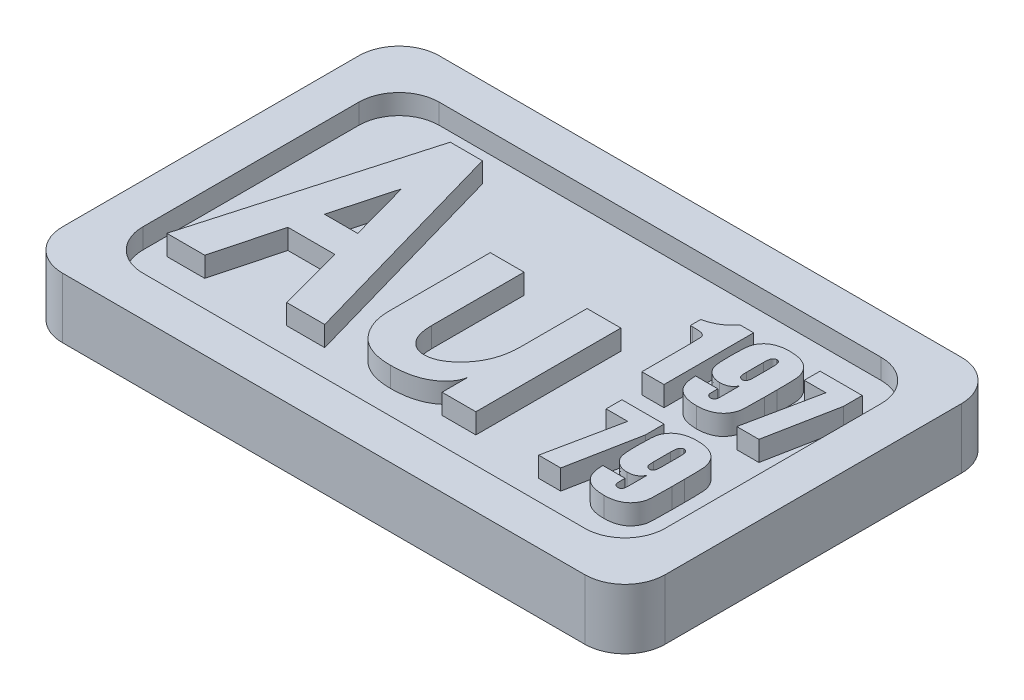
from build123d import *

# Parameters (mm, degrees)
SKETCH_1_W          = 30
SKETCH_1_H          = 18.75
EXTRUDE_1_DEPTH     = 3
SKETCH_2_W          = 26
SKETCH_2_H          = 14.75
CUT_EXTRUDE_1_DEPTH = 1
EXTRUDE_2_DEPTH     = 1
FILLET_1_R          = 2


# Read off the part's stored shape, not the designer's step: 凸台-拉伸2
with BuildPart() as part:
    # 草图1 → 凸台-拉伸1 (new body)
    with BuildSketch(Plane(origin=(0, 0, 0), x_dir=(1, 0, 0), z_dir=(0, 1, 0))):
        Rectangle(SKETCH_1_W, SKETCH_1_H)
    extrude(amount=EXTRUDE_1_DEPTH)

    # 草图2 → 切除-拉伸1 (cut)
    with BuildSketch(Plane(origin=(0, 3, 0), x_dir=(1, 0, 0), z_dir=(0, 1, 0))):
        Rectangle(SKETCH_2_W, SKETCH_2_H)
    extrude(amount=-CUT_EXTRUDE_1_DEPTH, mode=Mode.SUBTRACT)

    # 凸台-拉伸2 outline → 凸台-拉伸2 (add)
    # profile 1 of 7: a face of its own
    with BuildSketch(Plane(origin=(0, 2, 0), x_dir=(1, 0, 0), z_dir=(0, 1, 0))):
        with BuildLine():
            add(Edge.make_bspline(
                [(-0.49497841, -3.897554093), (-0.433377604, -3.895587842), (-0.310575442, -3.89166809), (-0.128436299, -3.851070544), (0.052126652, -3.791140322), (0.230369493, -3.703428185), (0.405224749, -3.590283388), (0.578108688, -3.454158283), (0.749023916, -3.294491178), (0.914698691, -3.112433725), (1.070169318, -2.911233763), (1.207394735, -2.695457715), (1.323253229, -2.466766056), (1.415172752, -2.225597955), (1.492075857, -1.973014851), (1.540332356, -1.706967124), (1.576078235, -1.429933144), (1.578449061, -1.241054368), (1.579660032, -1.144578812)],
                knots=[0, 0, 0, 0, 0.048740531, 0.097165006, 0.147206639, 0.199253696, 0.254081932, 0.311974285, 0.37340309, 0.439217829, 0.506831218, 0.574646171, 0.641560637, 0.709596063, 0.778953278, 0.850442408, 0.92360893, 1, 1, 1, 1], degree=3))
            add(Edge.make_bspline(
                [(-1.555608175, -2.440645074), (-1.552743452, -2.555156281), (-1.547359996, -2.770348536), (-1.489342941, -3.071323565), (-1.393058753, -3.328085277), (-1.256119876, -3.537080418), (-1.091383791, -3.6976357), (-0.907772973, -3.812812622), (-0.706747825, -3.884386695), (-0.566264542, -3.893121664), (-0.49497841, -3.897554093)],
                knots=[0, 0, 0, 0, 0.169866067, 0.31921646, 0.452923041, 0.574531854, 0.68713663, 0.791831685, 0.894368114, 1, 1, 1, 1], degree=3))
            Line((-1.555608175, -2.440645074), (-1.555608175, 2.156194259))
            Line((-1.555608175, 2.156194259), (-3.238629472, 2.156194259))
            Line((-3.238629472, 2.156194259), (-3.238629472, -2.874221198))
            add(Edge.make_bspline(
                [(-0.865616064, -5.184296137), (-0.961314701, -5.183131141), (-1.146328756, -5.180878854), (-1.414237615, -5.145801427), (-1.66446375, -5.096545478), (-1.897099105, -5.023385997), (-2.112409358, -4.931603282), (-2.30720798, -4.814826378), (-2.487387639, -4.682593083), (-2.643950938, -4.525079783), (-2.784427751, -4.354850568), (-2.905592974, -4.172474709), (-3.008770404, -3.980542016), (-3.092926198, -3.779093736), (-3.158787986, -3.567643811), (-3.204700803, -3.345918969), (-3.233619572, -3.113529852), (-3.236935898, -2.955118399), (-3.238629472, -2.874221198)],
                knots=[0, 0, 0, 0, 0.076545703, 0.147985711, 0.215931258, 0.28045695, 0.342855068, 0.402805737, 0.461895164, 0.521271974, 0.58004629, 0.638354701, 0.696236913, 0.754225968, 0.812851994, 0.873236686, 0.935264799, 1, 1, 1, 1], degree=3))
            add(Edge.make_bspline(
                [(1.579660032, -3.76468399), (1.570946388, -3.813980746), (1.553621833, -3.911993043), (1.502714818, -4.053540776), (1.435099226, -4.188723182), (1.349769241, -4.317904302), (1.248769792, -4.442501039), (1.129545038, -4.561601526), (0.991271943, -4.672848795), (0.837772062, -4.777412957), (0.669703856, -4.873099001), (0.487616716, -4.957652462), (0.291773041, -5.025726036), (0.085231348, -5.085743184), (-0.13492256, -5.12859473), (-0.367475499, -5.161721589), (-0.612801004, -5.179807744), (-0.780117651, -5.182778227), (-0.865616064, -5.184296137)],
                knots=[0, 0, 0, 0, 0.048864077, 0.097152041, 0.146410118, 0.196342996, 0.248186483, 0.30297375, 0.360749573, 0.421428631, 0.484366891, 0.549623221, 0.617378298, 0.686869728, 0.759717715, 0.836420189, 0.916411102, 1, 1, 1, 1], degree=3))
            Line((1.579660032, -3.76468399), (1.579660032, -5.060750253))
            Line((1.579660032, -5.060750253), (3.26268133, -5.060750253))
            Line((3.26268133, -5.060750253), (3.26268133, 2.156194259))
            Line((3.26268133, 2.156194259), (1.579660032, 2.156194259))
            Line((1.579660032, 2.156194259), (1.579660032, -1.144578812))
        make_face()
    # profile 2 of 7: a face of its own
    with BuildSketch(Plane(origin=(0, 2, 0), x_dir=(1, 0, 0), z_dir=(0, 1, 0))):
        with BuildLine():
            add(Edge.make_bspline(
                [(4.882287325, 4.509025937), (4.946827309, 4.525251779), (5.073198235, 4.557022391), (5.254534014, 4.620773061), (5.424243572, 4.696179274), (5.581966922, 4.783811942), (5.727601991, 4.883726499), (5.860925589, 4.995920894), (5.983377677, 5.119537049), (6.054215529, 5.21119793), (6.089675755, 5.257081811)],
                knots=[0, 0, 0, 0, 0.137436332, 0.269103825, 0.396548473, 0.520712192, 0.641361843, 0.760846104, 0.880283619, 1, 1, 1, 1], degree=3))
            Line((4.882287325, 4.509025937), (4.882287325, 3.997198233))
            Line((4.882287325, 3.997198233), (4.995479991, 3.997198233))
            add(Edge.make_bspline(
                [(5.669714562, 3.168759161), (5.669901444, 3.20949929), (5.670255158, 3.286608881), (5.667907959, 3.395961092), (5.667109271, 3.492511738), (5.663321985, 3.576155318), (5.660247136, 3.646983407), (5.656829041, 3.705080205), (5.650809928, 3.750144786), (5.644030229, 3.793114958), (5.62835517, 3.836501303), (5.597771464, 3.880502728), (5.55538766, 3.916769383), (5.511976021, 3.941668416), (5.468858662, 3.957777501), (5.426876075, 3.967620183), (5.376683767, 3.977970887), (5.317389796, 3.984661285), (5.249289071, 3.990427442), (5.172413938, 3.994318748), (5.086816463, 3.99679614), (5.026924475, 3.997059804), (4.995479991, 3.997198233)],
                knots=[0, 0, 0, 0, 0.090450116, 0.171196596, 0.24283852, 0.304804984, 0.357067531, 0.400274664, 0.433931616, 0.457984807, 0.496778911, 0.535171982, 0.575603368, 0.619650947, 0.645584039, 0.677533442, 0.715273069, 0.759320649, 0.809884484, 0.867027641, 0.930186868, 1, 1, 1, 1], degree=3))
            Line((5.669714562, 3.168759161), (5.669714562, 0.794994138))
            Line((5.669714562, 0.794994138), (6.772112693, 0.794994138))
            Line((6.772112693, 0.794994138), (6.772112693, 5.257081811))
            Line((6.772112693, 5.257081811), (6.089675755, 5.257081811))
        make_face()
    # profile 3 of 7: a face of its own
    with BuildSketch(Plane(origin=(0, 2, 0), x_dir=(1, 0, 0), z_dir=(0, 1, 0))):
        with BuildLine():
            add(Edge.make_bspline(
                [(8.498710956, 0.690003839), (8.460973859, 0.690551918), (8.387355605, 0.691621121), (8.279422135, 0.69775022), (8.177094783, 0.710307388), (8.079709094, 0.726913162), (7.987268905, 0.746408466), (7.900758944, 0.773451054), (7.819108079, 0.803412282), (7.7429587, 0.838712728), (7.671953508, 0.878220451), (7.606360216, 0.921844655), (7.545223946, 0.968649785), (7.489199665, 1.019399713), (7.439233912, 1.074775376), (7.393714222, 1.133264073), (7.353272672, 1.195655385), (7.30692798, 1.286111634), (7.25978929, 1.410759992), (7.220117322, 1.574919277), (7.196468529, 1.756721009), (7.193580875, 1.883647729), (7.192073886, 1.949887418)],
                knots=[0, 0, 0, 0, 0.054148679, 0.105634282, 0.155022211, 0.201972508, 0.247373081, 0.290433841, 0.331894172, 0.37208801, 0.410724, 0.448369444, 0.485012265, 0.521111385, 0.556656323, 0.591888161, 0.627361591, 0.663154608, 0.737537619, 0.817934864, 0.904985033, 1, 1, 1, 1], degree=3))
            add(Edge.make_bspline(
                [(9.816831341, 2.759461045), (9.817000858, 2.695208393), (9.81732475, 2.572442258), (9.815129836, 2.396642885), (9.813813497, 2.237511291), (9.811524763, 2.09505209), (9.807799406, 1.969303071), (9.805401683, 1.860148659), (9.799802643, 1.767509291), (9.794476647, 1.666178994), (9.778138573, 1.551464975), (9.739955733, 1.420232013), (9.682172108, 1.293443456), (9.609208002, 1.171053847), (9.519718912, 1.057392967), (9.412142673, 0.95950595), (9.291632171, 0.874683796), (9.155953948, 0.806802543), (9.007738929, 0.754798531), (8.84801626, 0.717163858), (8.677122532, 0.69375205), (8.55921244, 0.691274902), (8.498710956, 0.690003839)],
                knots=[0, 0, 0, 0, 0.06682017, 0.127671834, 0.182836948, 0.232319661, 0.275838722, 0.313673194, 0.345849005, 0.372347709, 0.419195017, 0.465986202, 0.51396914, 0.563708527, 0.613888094, 0.663791383, 0.714432853, 0.766696737, 0.82101706, 0.877432093, 0.93710852, 1, 1, 1, 1], degree=3))
            Line((9.816831341, 2.759461045), (9.816831341, 3.384481414))
            add(Edge.make_bspline(
                [(8.458519358, 5.362072109), (8.494349648, 5.361932426), (8.564162183, 5.361660263), (8.66646187, 5.35445108), (8.763588156, 5.344812527), (8.856296839, 5.332179693), (8.943723296, 5.313684931), (9.026649971, 5.29293263), (9.104408567, 5.26719726), (9.200111999, 5.228449777), (9.310729945, 5.171600859), (9.429343213, 5.088436283), (9.531621585, 4.990444207), (9.616305703, 4.879599273), (9.684664474, 4.761070482), (9.737708717, 4.6385744), (9.775729066, 4.513199259), (9.791409907, 4.403350155), (9.79851469, 4.307306311), (9.803460655, 4.220067235), (9.807101783, 4.117777808), (9.81174086, 4.000238605), (9.81374085, 3.867605189), (9.815148848, 3.719958905), (9.817317582, 3.557282987), (9.816998291, 3.443812651), (9.816831341, 3.384481414)],
                knots=[0, 0, 0, 0, 0.037867792, 0.07378245, 0.108351864, 0.141052264, 0.172625777, 0.2027699, 0.231378371, 0.259127086, 0.311870738, 0.36247223, 0.411737808, 0.46099321, 0.50942766, 0.556032901, 0.601850854, 0.64747055, 0.672985835, 0.703672421, 0.739830492, 0.781187531, 0.828018975, 0.880048205, 0.937279745, 1, 1, 1, 1], degree=3))
            add(Edge.make_bspline(
                [(7.192073886, 3.820027105), (7.192275474, 3.858032319), (7.192667065, 3.931858644), (7.194411721, 4.038762975), (7.196449812, 4.138044221), (7.200934285, 4.229620196), (7.205347653, 4.313621929), (7.212124282, 4.390164213), (7.219488327, 4.459078059), (7.229721196, 4.540912506), (7.251080767, 4.636998434), (7.291715579, 4.746589801), (7.346493233, 4.851887076), (7.41546733, 4.951715363), (7.497971973, 5.045189311), (7.597177162, 5.12683617), (7.710471624, 5.197369012), (7.83726519, 5.257269547), (7.976747579, 5.304687149), (8.128079786, 5.337756384), (8.28977847, 5.358784929), (8.401308353, 5.360957603), (8.458519358, 5.362072109)],
                knots=[0, 0, 0, 0, 0.048829982, 0.094853777, 0.137372414, 0.17640467, 0.21264844, 0.245438663, 0.275115552, 0.301695142, 0.351380657, 0.401171617, 0.451449676, 0.503482672, 0.556723037, 0.61110089, 0.667923462, 0.727791664, 0.79089025, 0.856769206, 0.926527514, 1, 1, 1, 1], degree=3))
            Line((7.192073886, 3.820027105), (7.192073886, 3.462403901))
            add(Edge.make_bspline(
                [(8.071367633, 2.264858312), (8.022795418, 2.266861011), (7.927616818, 2.270785353), (7.789688499, 2.303070926), (7.660440146, 2.355186827), (7.542955599, 2.427807956), (7.440698245, 2.514695317), (7.355666998, 2.610717374), (7.292127617, 2.716346445), (7.249532593, 2.833252291), (7.223905361, 2.963950146), (7.205536095, 3.111985353), (7.194279211, 3.280415925), (7.192836138, 3.399501267), (7.192073886, 3.462403901)],
                knots=[0, 0, 0, 0, 0.085572682, 0.167682039, 0.248354654, 0.330387529, 0.410090359, 0.484251002, 0.555612718, 0.62609759, 0.702507836, 0.790002774, 0.889076366, 1, 1, 1, 1], degree=3))
            add(Edge.make_bspline(
                [(8.71443321, 2.632324356), (8.700351334, 2.60305905), (8.672773573, 2.545746258), (8.615747002, 2.470493681), (8.549492176, 2.406299831), (8.472860896, 2.354094183), (8.386197296, 2.31347709), (8.289624795, 2.285359441), (8.183557978, 2.267778878), (8.109718682, 2.265856676), (8.071367633, 2.264858312)],
                knots=[0, 0, 0, 0, 0.123260157, 0.24139107, 0.356855571, 0.472806044, 0.592356435, 0.719349974, 0.854234488, 1, 1, 1, 1], degree=3))
            Line((8.71443321, 2.632324356), (8.71443321, 1.904774399))
            add(Edge.make_bspline(
                [(8.517576401, 1.372440778), (8.530487457, 1.373024888), (8.555354514, 1.3741499), (8.591107265, 1.384192968), (8.622435463, 1.402095092), (8.650729349, 1.424942269), (8.673696935, 1.453914552), (8.690873687, 1.487477995), (8.703698478, 1.524421187), (8.708670658, 1.568642293), (8.711886637, 1.624462927), (8.712747888, 1.698904353), (8.715020574, 1.794575956), (8.714641621, 1.865673384), (8.71443321, 1.904774399)],
                knots=[0, 0, 0, 0, 0.060442793, 0.116414519, 0.172047867, 0.228487006, 0.285921061, 0.343810724, 0.404592134, 0.468017438, 0.551465, 0.66681809, 0.816761996, 1, 1, 1, 1], degree=3))
            add(Edge.make_bspline(
                [(8.294472017, 1.949887418), (8.294359586, 1.925553117), (8.294144824, 1.879070182), (8.295591035, 1.8129106), (8.29510369, 1.753576713), (8.295709752, 1.701336077), (8.298028367, 1.656260322), (8.298115445, 1.618483155), (8.300175335, 1.587888698), (8.301674356, 1.556748988), (8.308061291, 1.523580019), (8.321475673, 1.487617085), (8.340212574, 1.454581325), (8.365178337, 1.425581132), (8.395410562, 1.401271516), (8.432206496, 1.385029983), (8.473175512, 1.373888255), (8.502457815, 1.372933647), (8.517576401, 1.372440778)],
                knots=[0, 0, 0, 0, 0.103440378, 0.197589918, 0.281272021, 0.355665192, 0.419631271, 0.473107469, 0.51617355, 0.549958902, 0.605577218, 0.658901638, 0.712529183, 0.766106327, 0.820744507, 0.875862681, 0.935907339, 1, 1, 1, 1], degree=3))
            Line((8.294472017, 1.949887418), (7.192073886, 1.949887418))
        make_face()
        with BuildLine():
            add(Edge.make_bspline(
                [(8.294472017, 3.368896917), (8.294561822, 3.346201176), (8.294732885, 3.30296958), (8.297813295, 3.241629889), (8.303773197, 3.187218781), (8.310596745, 3.139404837), (8.320607365, 3.09834824), (8.331473453, 3.063658179), (8.345295176, 3.03562762), (8.367017638, 3.009206251), (8.395863605, 2.984795494), (8.431692025, 2.96425841), (8.467518122, 2.949477542), (8.492287365, 2.94801404), (8.504452613, 2.947295251)],
                knots=[0, 0, 0, 0, 0.129046492, 0.245812019, 0.348995351, 0.440245001, 0.520185585, 0.589013502, 0.646724848, 0.696498387, 0.782498161, 0.8598261, 0.931154527, 1, 1, 1, 1], degree=3))
            Line((8.294472017, 3.368896917), (8.294472017, 4.221122853))
            add(Edge.make_bspline(
                [(8.506913323, 4.679635171), (8.495571272, 4.67887201), (8.47153208, 4.677254508), (8.436364131, 4.661840133), (8.400256125, 4.63913421), (8.370935125, 4.613071225), (8.347105308, 4.585512949), (8.334541971, 4.554557572), (8.320625826, 4.518069094), (8.311849989, 4.472854466), (8.303051928, 4.420726998), (8.299388034, 4.36057165), (8.294268467, 4.293384686), (8.294401893, 4.246017395), (8.294472017, 4.221122853)],
                knots=[0, 0, 0, 0, 0.060332353, 0.127872904, 0.202038451, 0.28792209, 0.336740917, 0.394894353, 0.464657071, 0.54545895, 0.640077979, 0.747068577, 0.86706836, 1, 1, 1, 1], degree=3))
            add(Edge.make_bspline(
                [(8.71443321, 4.193234805), (8.714327578, 4.217299849), (8.714125855, 4.263256169), (8.711214364, 4.328856624), (8.708765167, 4.388044593), (8.702494961, 4.440480415), (8.696421076, 4.486569606), (8.688315777, 4.526070975), (8.678786749, 4.559162721), (8.66397952, 4.593486345), (8.640326359, 4.627722515), (8.603929325, 4.659325971), (8.557498035, 4.676695616), (8.524272217, 4.678626419), (8.506913323, 4.679635171)],
                knots=[0, 0, 0, 0, 0.121572996, 0.232164444, 0.33178021, 0.42071848, 0.498863516, 0.566595476, 0.624285357, 0.672536358, 0.754925189, 0.832395756, 0.912434834, 1, 1, 1, 1], degree=3))
            Line((8.71443321, 4.193234805), (8.71443321, 3.368896917))
            add(Edge.make_bspline(
                [(8.504452613, 2.947295251), (8.521518887, 2.94841581), (8.553985352, 2.950547535), (8.599673093, 2.966271328), (8.636640513, 2.994698799), (8.667724866, 3.034484911), (8.689080303, 3.091273374), (8.704861867, 3.165772498), (8.71262784, 3.260750775), (8.713794105, 3.330612944), (8.71443321, 3.368896917)],
                knots=[0, 0, 0, 0, 0.096158159, 0.182928953, 0.267692014, 0.355550885, 0.464023958, 0.60611065, 0.784151435, 1, 1, 1, 1], degree=3))
        make_face(mode=Mode.SUBTRACT)
    # profile 4 of 7: a face of its own
    with BuildSketch(Plane(origin=(0, 2, 0), x_dir=(1, 0, 0), z_dir=(0, 1, 0))):
        with BuildLine():
            add(Edge.make_bspline(
                [(10.048860784, -5.47577079), (10.011123686, -5.475222711), (9.937505432, -5.474153508), (9.829571963, -5.46802441), (9.72724461, -5.455467242), (9.629858922, -5.438861467), (9.537418733, -5.419366164), (9.450908772, -5.392323575), (9.369257907, -5.362362348), (9.293108528, -5.327061901), (9.222103335, -5.287554178), (9.156510044, -5.243929974), (9.095373774, -5.197124845), (9.039349493, -5.146374916), (8.98938374, -5.090999254), (8.94386405, -5.032510556), (8.9034225, -4.970119245), (8.857077808, -4.879662996), (8.809939118, -4.755014637), (8.77026715, -4.590855352), (8.746618356, -4.40905362), (8.743730703, -4.282126901), (8.742223713, -4.215887211)],
                knots=[0, 0, 0, 0, 0.054148679, 0.105634282, 0.155022211, 0.201972508, 0.247373081, 0.290433841, 0.331894172, 0.37208801, 0.410724, 0.448369444, 0.485012265, 0.521111385, 0.556656323, 0.591888161, 0.627361591, 0.663154608, 0.737537619, 0.817934864, 0.904985033, 1, 1, 1, 1], degree=3))
            add(Edge.make_bspline(
                [(11.366981169, -3.406313584), (11.367150686, -3.470566237), (11.367474578, -3.593332371), (11.365279663, -3.769131745), (11.363963324, -3.928263339), (11.36167459, -4.07072254), (11.357949233, -4.196471558), (11.35555151, -4.30562597), (11.34995247, -4.398265338), (11.344626474, -4.499595635), (11.328288401, -4.614309654), (11.290105561, -4.745542616), (11.232321936, -4.872331173), (11.15935783, -4.994720782), (11.06986874, -5.108381662), (10.9622925, -5.206268679), (10.841781999, -5.291090834), (10.706103775, -5.358972086), (10.557888756, -5.410976098), (10.398166088, -5.448610771), (10.22727236, -5.47202258), (10.109362268, -5.474499727), (10.048860784, -5.47577079)],
                knots=[0, 0, 0, 0, 0.06682017, 0.127671834, 0.182836948, 0.232319661, 0.275838722, 0.313673194, 0.345849005, 0.372347709, 0.419195017, 0.465986202, 0.51396914, 0.563708527, 0.613888094, 0.663791383, 0.714432853, 0.766696737, 0.82101706, 0.877432093, 0.93710852, 1, 1, 1, 1], degree=3))
            Line((11.366981169, -3.406313584), (11.366981169, -2.781293215))
            add(Edge.make_bspline(
                [(10.008669186, -0.80370252), (10.044499475, -0.803842203), (10.11431201, -0.804114366), (10.216611698, -0.81132355), (10.313737984, -0.820962103), (10.406446667, -0.833594936), (10.493873124, -0.852089698), (10.576799798, -0.872841999), (10.654558394, -0.89857737), (10.750261826, -0.937324852), (10.860879772, -0.994173771), (10.97949304, -1.077338346), (11.081771412, -1.175330422), (11.166455531, -1.286175356), (11.234814302, -1.404704147), (11.287858545, -1.527200229), (11.325878893, -1.65257537), (11.341559735, -1.762424474), (11.348664517, -1.858468318), (11.353610482, -1.945707394), (11.357251611, -2.047996821), (11.361890688, -2.165536025), (11.363890678, -2.298169441), (11.365298675, -2.445815724), (11.36746741, -2.608491643), (11.367148119, -2.721961978), (11.366981169, -2.781293215)],
                knots=[0, 0, 0, 0, 0.037867792, 0.07378245, 0.108351864, 0.141052264, 0.172625777, 0.2027699, 0.231378371, 0.259127086, 0.311870738, 0.36247223, 0.411737808, 0.46099321, 0.50942766, 0.556032901, 0.601850854, 0.64747055, 0.672985835, 0.703672421, 0.739830492, 0.781187531, 0.828018975, 0.880048205, 0.937279745, 1, 1, 1, 1], degree=3))
            add(Edge.make_bspline(
                [(8.742223713, -2.345747525), (8.742425302, -2.30774231), (8.742816893, -2.233915985), (8.744561548, -2.127011654), (8.74659964, -2.027730409), (8.751084113, -1.936154433), (8.75549748, -1.8521527), (8.762274109, -1.775610416), (8.769638155, -1.70669657), (8.779871023, -1.624862123), (8.801230595, -1.528776196), (8.841865407, -1.419184828), (8.896643061, -1.313887553), (8.965617157, -1.214059266), (9.048121801, -1.120585318), (9.14732699, -1.038938459), (9.260621451, -0.968405618), (9.387415018, -0.908505082), (9.526897407, -0.86108748), (9.678229613, -0.828018245), (9.839928298, -0.8069897), (9.95145818, -0.804817027), (10.008669186, -0.80370252)],
                knots=[0, 0, 0, 0, 0.048829982, 0.094853777, 0.137372414, 0.17640467, 0.21264844, 0.245438663, 0.275115552, 0.301695142, 0.351380657, 0.401171617, 0.451449676, 0.503482672, 0.556723037, 0.61110089, 0.667923462, 0.727791664, 0.79089025, 0.856769206, 0.926527514, 1, 1, 1, 1], degree=3))
            Line((8.742223713, -2.345747525), (8.742223713, -2.703370728))
            add(Edge.make_bspline(
                [(9.621517461, -3.900916317), (9.572945246, -3.898913619), (9.477766646, -3.894989276), (9.339838327, -3.862703703), (9.210589974, -3.810587802), (9.093105426, -3.737966673), (8.990848073, -3.651079312), (8.905816825, -3.555057255), (8.842277445, -3.449428185), (8.799682421, -3.332522338), (8.774055189, -3.201824483), (8.755685923, -3.053789277), (8.744429039, -2.885358704), (8.742985966, -2.766273363), (8.742223713, -2.703370728)],
                knots=[0, 0, 0, 0, 0.085572682, 0.167682039, 0.248354654, 0.330387529, 0.410090359, 0.484251002, 0.555612718, 0.62609759, 0.702507836, 0.790002774, 0.889076366, 1, 1, 1, 1], degree=3))
            add(Edge.make_bspline(
                [(10.264583037, -3.533450273), (10.250501161, -3.56271558), (10.222923401, -3.620028371), (10.16589683, -3.695280948), (10.099642003, -3.759474799), (10.023010724, -3.811680447), (9.936347123, -3.85229754), (9.839774623, -3.880415188), (9.733707806, -3.897995751), (9.659868509, -3.899917953), (9.621517461, -3.900916317)],
                knots=[0, 0, 0, 0, 0.123260157, 0.24139107, 0.356855571, 0.472806044, 0.592356435, 0.719349974, 0.854234488, 1, 1, 1, 1], degree=3))
            Line((10.264583037, -3.533450273), (10.264583037, -4.26100023))
            add(Edge.make_bspline(
                [(10.067726228, -4.793333852), (10.080637284, -4.792749741), (10.105504342, -4.791624729), (10.141257093, -4.781581662), (10.17258529, -4.763679537), (10.200879177, -4.740832361), (10.223846763, -4.711860078), (10.241023514, -4.678296634), (10.253848306, -4.641353443), (10.258820486, -4.597132336), (10.262036465, -4.541311702), (10.262897716, -4.466870277), (10.265170402, -4.371198673), (10.264791448, -4.300101245), (10.264583037, -4.26100023)],
                knots=[0, 0, 0, 0, 0.060442793, 0.116414519, 0.172047867, 0.228487006, 0.285921061, 0.343810724, 0.404592134, 0.468017438, 0.551465, 0.66681809, 0.816761996, 1, 1, 1, 1], degree=3))
            add(Edge.make_bspline(
                [(9.844621845, -4.215887211), (9.844509414, -4.240221512), (9.844294651, -4.286704448), (9.845740863, -4.35286403), (9.845253518, -4.412197916), (9.84585958, -4.464438552), (9.848178194, -4.509514307), (9.848265272, -4.547291475), (9.850325163, -4.577885931), (9.851824184, -4.609025642), (9.858211119, -4.64219461), (9.871625501, -4.678157544), (9.890362402, -4.711193305), (9.915328165, -4.740193497), (9.94556039, -4.764503113), (9.982356323, -4.780744646), (10.02332534, -4.791886374), (10.052607643, -4.792840983), (10.067726228, -4.793333852)],
                knots=[0, 0, 0, 0, 0.103440378, 0.197589918, 0.281272021, 0.355665192, 0.419631271, 0.473107469, 0.51617355, 0.549958902, 0.605577218, 0.658901638, 0.712529183, 0.766106327, 0.820744507, 0.875862681, 0.935907339, 1, 1, 1, 1], degree=3))
            Line((9.844621845, -4.215887211), (8.742223713, -4.215887211))
        make_face()
        with BuildLine():
            add(Edge.make_bspline(
                [(9.844621845, -2.796877712), (9.844711649, -2.819573453), (9.844882712, -2.862805049), (9.847963122, -2.92414474), (9.853923025, -2.978555848), (9.860746573, -3.026369792), (9.870757193, -3.06742639), (9.881623281, -3.10211645), (9.895445004, -3.130147009), (9.917167465, -3.156568379), (9.946013433, -3.180979135), (9.981841853, -3.201516219), (10.01766795, -3.216297088), (10.042437193, -3.217760589), (10.054602441, -3.218479379)],
                knots=[0, 0, 0, 0, 0.129046492, 0.245812019, 0.348995351, 0.440245001, 0.520185585, 0.589013502, 0.646724848, 0.696498387, 0.782498161, 0.8598261, 0.931154527, 1, 1, 1, 1], degree=3))
            Line((9.844621845, -2.796877712), (9.844621845, -1.944651776))
            add(Edge.make_bspline(
                [(10.057063151, -1.486139458), (10.0457211, -1.48690262), (10.021681908, -1.488520121), (9.986513959, -1.503934497), (9.950405952, -1.526640419), (9.921084953, -1.552703404), (9.897255135, -1.58026168), (9.884691799, -1.611217057), (9.870775654, -1.647705535), (9.861999817, -1.692920163), (9.853201756, -1.745047631), (9.849537862, -1.805202979), (9.844418295, -1.872389943), (9.844551721, -1.919757235), (9.844621845, -1.944651776)],
                knots=[0, 0, 0, 0, 0.060332353, 0.127872904, 0.202038451, 0.28792209, 0.336740917, 0.394894353, 0.464657071, 0.54545895, 0.640077979, 0.747068577, 0.86706836, 1, 1, 1, 1], degree=3))
            add(Edge.make_bspline(
                [(10.264583037, -1.972539824), (10.264477405, -1.94847478), (10.264275683, -1.90251846), (10.261364192, -1.836918005), (10.258914994, -1.777730036), (10.252644789, -1.725294214), (10.246570903, -1.679205023), (10.238465605, -1.639703655), (10.228936576, -1.606611909), (10.214129347, -1.572288285), (10.190476186, -1.538052114), (10.154079153, -1.506448658), (10.107647863, -1.489079013), (10.074422045, -1.48714821), (10.057063151, -1.486139458)],
                knots=[0, 0, 0, 0, 0.121572996, 0.232164444, 0.33178021, 0.42071848, 0.498863516, 0.566595476, 0.624285357, 0.672536358, 0.754925189, 0.832395756, 0.912434834, 1, 1, 1, 1], degree=3))
            Line((10.264583037, -1.972539824), (10.264583037, -2.796877712))
            add(Edge.make_bspline(
                [(10.054602441, -3.218479379), (10.071668715, -3.217358819), (10.10413518, -3.215227094), (10.149822921, -3.199503302), (10.186790341, -3.17107583), (10.217874694, -3.131289718), (10.23923013, -3.074501255), (10.255011695, -3.000002132), (10.262777668, -2.905023854), (10.263943933, -2.835161685), (10.264583037, -2.796877712)],
                knots=[0, 0, 0, 0, 0.096158159, 0.182928953, 0.267692014, 0.355550885, 0.464023958, 0.60611065, 0.784151435, 1, 1, 1, 1], degree=3))
        make_face(mode=Mode.SUBTRACT)
    # profile 5 of 7: a face of its own
    with BuildSketch(Plane(origin=(0, 2, 0), x_dir=(1, 0, 0), z_dir=(0, 1, 0))):
        Polygon((-6.159440672, -5.060750253), (-4.261962367, -5.060750253), (-7.397230574, 5.923178217), (-8.996333912, 5.923178217), (-12.122277901, -5.060750253), (-10.234123814, -5.060750253), (-9.369302621, -1.787949834), (-7.024261865, -1.787949834), align=None)
        Polygon((-8.19733644, 2.6990557), (-7.366926866, -0.314723435), (-9.019644456, -0.314723435), align=None, mode=Mode.SUBTRACT)
    # profile 6 of 7: a face of its own
    with BuildSketch(Plane(origin=(0, 2, 0), x_dir=(1, 0, 0), z_dir=(0, 1, 0))):
        Polygon((12.17911305, 4.325292915), (12.17911305, 5.257081811), (10.079307086, 5.257081811), (10.079307086, 4.469654575), (11.155457643, 4.469654575), (10.394277981, 0.794994138), (11.496676112, 0.794994138), align=None)
    # profile 7 of 7: a face of its own
    with BuildSketch(Plane(origin=(0, 2, 0), x_dir=(1, 0, 0), z_dir=(0, 1, 0))):
        Polygon((8.479747968, -1.840481715), (8.479747968, -0.908692818), (6.379942004, -0.908692818), (6.379942004, -1.696120055), (7.45609256, -1.696120055), (6.694912899, -5.370780492), (7.79731103, -5.370780492), align=None)
    extrude(amount=EXTRUDE_2_DEPTH)

    # 圆角1
    fillet_1_edges = [part.edges().sort_by_distance(p)[0] for p in [
        (13, 2.5, 7.375),
        (-13, 2.5, 7.375),
        (-13, 2.5, -7.375),
        (13, 2.5, -7.375),
        (15, 1.5, 9.375),
        (-15, 1.5, 9.375),
        (-15, 1.5, -9.375),
        (15, 1.5, -9.375),
    ]]
    fillet(fillet_1_edges, radius=FILLET_1_R)


solid = part.part
